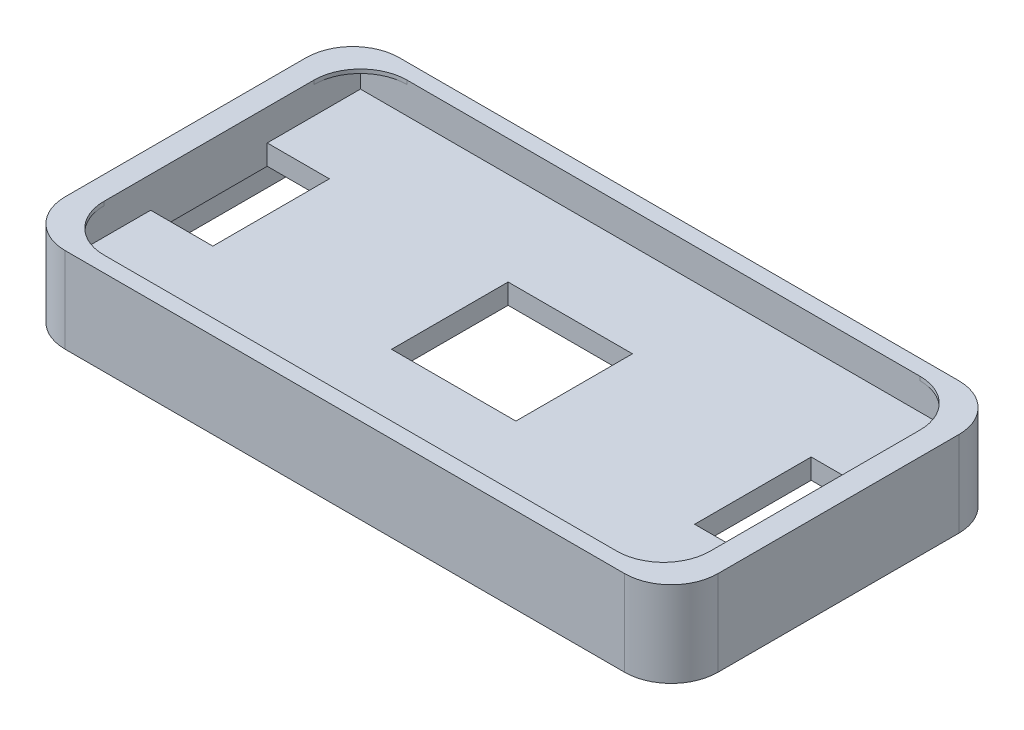
from build123d import *

# Parameters (mm, degrees)
EXTRUDE_1_DEPTH     = 10.5
CUT_EXTRUDE_1_DEPTH = 1
SKETCH_3_R          = 2.5
SKETCH_3_R_2        = 1.65
CUT_EXTRUDE_2_DEPTH = 3.4
SKETCH_4_W          = 78
SKETCH_4_H          = 39
CUT_EXTRUDE_3_DEPTH = 3.5
SKETCH_5_W          = 8
SKETCH_5_H          = 15
CUT_EXTRUDE_4_DEPTH = 48.699580711
SKETCH_6_W          = 16
SKETCH_6_H          = 15
CUT_EXTRUDE_5_DEPTH = 48.699580711
EXTRUDE_2_DEPTH     = 0.5


with BuildPart() as part:
    # 草图1 → 凸台-拉伸1 (new body)
    with BuildSketch(Plane(origin=(0, 0, 0), x_dir=(1, 0, 0), z_dir=(0, 1, 0))):
        with BuildLine():
            Line((-36, 21.5), (36, 21.5))
            ThreePointArc((36, 21.5), (40.242640687, 19.742640687), (42, 15.5))
            Line((42, 15.5), (42, -15.5))
            ThreePointArc((42, -15.5), (40.242640687, -19.742640687), (36, -21.5))
            Line((36, -21.5), (-36, -21.5))
            ThreePointArc((-36, -21.5), (-40.242640687, -19.742640687), (-42, -15.5))
            Line((-42, -15.5), (-42, 15.5))
            ThreePointArc((-42, 15.5), (-40.242640687, 19.742640687), (-36, 21.5))
        make_face()
    extrude(amount=EXTRUDE_1_DEPTH)

    # 草图2 → 切除-拉伸1 (cut)
    with BuildSketch(Plane.XZ):
        with BuildLine():
            Line((36, 20.5), (-36, 20.5))
            ThreePointArc((-36, 20.5), (-39.535533906, 19.035533906), (-41, 15.5))
            Line((-41, 15.5), (-41, -15.5))
            ThreePointArc((-41, -15.5), (-39.535533906, -19.035533906), (-36, -20.5))
            Line((-36, -20.5), (36, -20.5))
            ThreePointArc((36, -20.5), (39.535533906, -19.035533906), (41, -15.5))
            Line((41, -15.5), (41, 15.5))
            ThreePointArc((41, 15.5), (39.535533906, 19.035533906), (36, 20.5))
        make_face()
    extrude(amount=-CUT_EXTRUDE_1_DEPTH, mode=Mode.SUBTRACT)

    # 草图3 → 切除-拉伸2 (cut)
    # profile 1 of 5: a face of its own
    with BuildSketch(Plane(origin=(0, 1, 0), x_dir=(-1, 0, 0), z_dir=(0, -1, 0))):
        with BuildLine():
            ThreePointArc((-41, -15.5), (-39.535533906, -19.035533906), (-36, -20.5))
            Line((-36, -20.5), (36, -20.5))
            ThreePointArc((36, -20.5), (39.535533906, -19.035533906), (41, -15.5))
            Line((41, -15.5), (41, 15.5))
            ThreePointArc((41, 15.5), (39.535533906, 19.035533906), (36, 20.5))
            Line((36, 20.5), (-36, 20.5))
            ThreePointArc((-36, 20.5), (-39.535533906, 19.035533906), (-41, 15.5))
            Line((-41, 15.5), (-41, -15.5))
        make_face()
        with Locations((-36, -15.5)):
            Circle(SKETCH_3_R, mode=Mode.SUBTRACT)
        with Locations((36, -15.5)):
            Circle(SKETCH_3_R, mode=Mode.SUBTRACT)
        with Locations((-36, 15.5)):
            Circle(SKETCH_3_R, mode=Mode.SUBTRACT)
        with Locations((36, 15.5)):
            Circle(SKETCH_3_R, mode=Mode.SUBTRACT)
    # profile 2 of 5: a face of its own
    with BuildSketch(Plane(origin=(0, 1, 0), x_dir=(-1, 0, 0), z_dir=(0, -1, 0))):
        with Locations((36, -15.5)):
            Circle(SKETCH_3_R_2)
    # profile 3 of 5: a face of its own
    with BuildSketch(Plane(origin=(0, 1, 0), x_dir=(-1, 0, 0), z_dir=(0, -1, 0))):
        with Locations((36, 15.5)):
            Circle(SKETCH_3_R_2)
    # profile 4 of 5: a face of its own
    with BuildSketch(Plane(origin=(0, 1, 0), x_dir=(-1, 0, 0), z_dir=(0, -1, 0))):
        with Locations((-36, -15.5)):
            Circle(SKETCH_3_R_2)
    # profile 5 of 5: a face of its own
    with BuildSketch(Plane(origin=(0, 1, 0), x_dir=(-1, 0, 0), z_dir=(0, -1, 0))):
        with Locations((-36, 15.5)):
            Circle(SKETCH_3_R_2)
    extrude(amount=-CUT_EXTRUDE_2_DEPTH, mode=Mode.SUBTRACT)

    # 草图4 → 切除-拉伸3 (cut)
    with BuildSketch(Plane(origin=(0, 10.5, 0), x_dir=(1, 0, 0), z_dir=(0, 1, 0))):
        Rectangle(SKETCH_4_W, SKETCH_4_H)
    extrude(amount=-CUT_EXTRUDE_3_DEPTH, mode=Mode.SUBTRACT)

    # 草图5 → 切除-拉伸4 (cut, through all)
    with BuildSketch(Plane(origin=(0, 7, 0), x_dir=(1, 0, 0), z_dir=(0, 1, 0))):
        with Locations((-35, 0)):
            Rectangle(SKETCH_5_W, SKETCH_5_H)
        with Locations((35, 0)):
            Rectangle(SKETCH_5_W, SKETCH_5_H)
    extrude(amount=-CUT_EXTRUDE_4_DEPTH, mode=Mode.SUBTRACT)

    # 草图6 → 切除-拉伸5 (cut, through all)
    with BuildSketch(Plane(origin=(0, 7, 0), x_dir=(1, 0, 0), z_dir=(0, 1, 0))):
        Rectangle(SKETCH_6_W, SKETCH_6_H)
    extrude(amount=-CUT_EXTRUDE_5_DEPTH, mode=Mode.SUBTRACT)

    # 草图7 → 凸台-拉伸2 (add)
    with BuildSketch(Plane(origin=(0, 10.5, 0), x_dir=(1, 0, 0), z_dir=(0, 1, 0))):
        with BuildLine():
            Line((42, -15.5), (42, 15.5))
            ThreePointArc((42, 15.5), (40.242640687, 19.742640687), (36, 21.5))
            Line((36, 21.5), (-36, 21.5))
            ThreePointArc((-36, 21.5), (-40.242640687, 19.742640687), (-42, 15.5))
            Line((-42, 15.5), (-42, -15.5))
            ThreePointArc((-42, -15.5), (-40.242640687, -19.742640687), (-36, -21.5))
            Line((-36, -21.5), (36, -21.5))
            ThreePointArc((36, -21.5), (40.242640687, -19.742640687), (42, -15.5))
        make_face()
        with BuildLine():
            Line((-33, -19.5), (33, -19.5))
            ThreePointArc((33, -19.5), (37.242640687, -17.742640687), (39, -13.5))
            Line((39, -13.5), (39, 13.5))
            ThreePointArc((39, 13.5), (37.242640687, 17.742640687), (33, 19.5))
            Line((33, 19.5), (-33, 19.5))
            ThreePointArc((-33, 19.5), (-37.242640687, 17.742640687), (-39, 13.5))
            Line((-39, 13.5), (-39, -13.5))
            ThreePointArc((-39, -13.5), (-37.242640687, -17.742640687), (-33, -19.5))
        make_face(mode=Mode.SUBTRACT)
    extrude(amount=EXTRUDE_2_DEPTH)


solid = part.part
